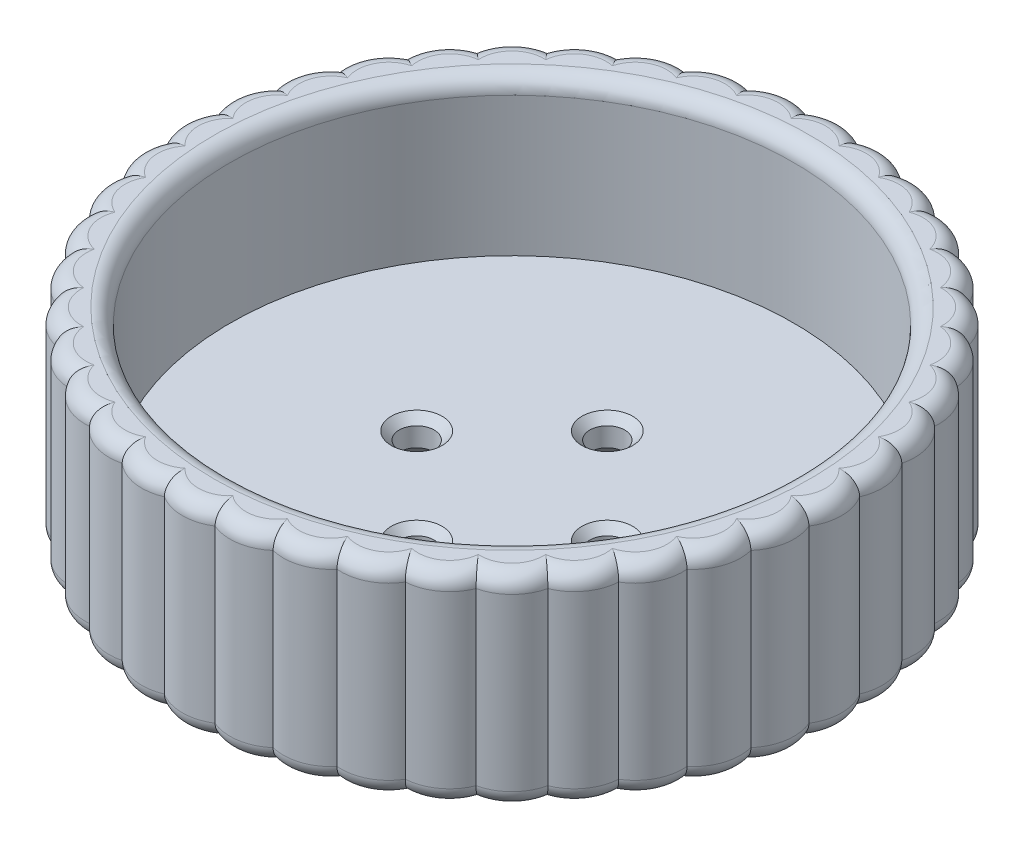
from build123d import *

# Parameters (mm, degrees)
SKETCH1_R           = 17.75
BOSS_EXTRUDE1_DEPTH = 3
SKETCH1_6_R         = 20.749999999999996
SKETCH1_6_R_2       = 17.75
BOSS_EXTRUDE2_DEPTH = 12.750000000000002
CHAMFER1_SIZE       = 1.3
FILLET3_R           = 1
CHAMFER2_SIZE       = 0.5
CUT_EXTRUDE7_DEPTH  = 12.75
FILLET7_R           = 1
FILLET8_R           = 1


with BuildPart() as part:
    # Sketch1 → Boss-Extrude1 (new body)
    # profile 1 of 2: a face of its own
    with BuildSketch(Plane(origin=(0, 0, 0), x_dir=(1, 0, 0), z_dir=(0, 1, 0))):
        with Locations(Location((0, 0, 0), (0, 0, 270))):
            Circle(SKETCH1_R)
        with BuildLine():
            ThreePointArc((-1.0953687228001776, -5.899166666666668), (-4.242640687119286, -4.242640687119284), (-5.899166666666668, -1.0953687228001758))
            ThreePointArc((-5.899166666666666, -1.0953687228001934), (-7.1, -1.917e-14), (-5.89916666666667, 1.0953687228001592))
            ThreePointArc((-5.899166666666668, 1.0953687228001765), (-4.242640687119286, 4.242640687119286), (-1.0953687228001763, 5.899166666666668))
            ThreePointArc((-1.095368722800176, 5.899166666666668), (-0.05046981731592814, 7.098841570718955), (1.1, 6.000000000000001))
            ThreePointArc((1.1, 6.000000000000001), (1.0988415707189536, 5.9495301826840725), (1.095368722800176, 5.899166666666669))
            ThreePointArc((1.0953687228001767, 5.899166666666669), (4.242640687119286, 4.2426406871192865), (5.899166666666668, 1.0953687228001765))
            ThreePointArc((5.899166666666668, 1.095368722800176), (6.741310776035711, 0.8126858761743884), (7.100000000000001, 0))
            ThreePointArc((7.100000000000001, -2.7e-16), (6.741310776035711, -0.8126858761743889), (5.899166666666668, -1.095368722800176))
            ThreePointArc((5.899166666666668, -1.0953687228001752), (4.242640687119286, -4.242640687119285), (1.0953687228001758, -5.899166666666668))
            ThreePointArc((1.095368722800176, -5.899166666666668), (1.0988415707189536, -5.9495301826840725), (1.1, -6.000000000000001))
            ThreePointArc((1.1, -6.000000000000001), (-0.05046981731592792, -7.098841570718955), (-1.095368722800176, -5.899166666666668))
        make_face(mode=Mode.SUBTRACT)
    # profile 2 of 2: a face of its own
    with BuildSketch(Plane(origin=(0, 0, 0), x_dir=(1, 0, 0), z_dir=(0, 1, 0))):
        with BuildLine():
            ThreePointArc((-4.899999999999999, -1.762e-14), (-5.187314123825611, -0.7413107760357274), (-5.899166666666666, -1.0953687228001934))
            ThreePointArc((-5.899166666666668, -1.0953687228001758), (-4.242640687119286, -4.242640687119284), (-1.0953687228001776, -5.899166666666668))
            ThreePointArc((-1.095368722800176, -5.899166666666668), (7e-17, -4.9), (1.095368722800176, -5.899166666666668))
            ThreePointArc((1.0953687228001758, -5.899166666666668), (4.242640687119286, -4.242640687119285), (5.899166666666668, -1.0953687228001752))
            ThreePointArc((5.899166666666668, -1.095368722800176), (4.9, 1.3e-16), (5.899166666666668, 1.095368722800176))
            ThreePointArc((5.899166666666668, 1.0953687228001765), (4.242640687119286, 4.2426406871192865), (1.0953687228001767, 5.899166666666669))
            ThreePointArc((1.095368722800176, 5.899166666666669), (-2e-16, 4.9), (-1.095368722800176, 5.899166666666668))
            ThreePointArc((-1.0953687228001763, 5.899166666666668), (-4.242640687119286, 4.242640687119286), (-5.899166666666668, 1.0953687228001765))
            ThreePointArc((-5.89916666666667, 1.0953687228001592), (-5.187314123825612, 0.7413107760356942), (-4.899999999999999, -1.735e-14))
        make_face()
    extrude(amount=BOSS_EXTRUDE1_DEPTH)

    # Sketch1<6> → Boss-Extrude2 (add)
    with BuildSketch(Plane(origin=(0, 0, 0), x_dir=(1, 0, 0), z_dir=(0, 1, 0))):
        with Locations(Location((0, 0, 0), (0, 0, 270))):
            Circle(SKETCH1_6_R)
        with Locations(Location((0, 0, 0), (0, 0, 270))):
            Circle(SKETCH1_6_R_2, mode=Mode.SUBTRACT)
    extrude(amount=BOSS_EXTRUDE2_DEPTH)

    # Chamfer1
    chamfer1_edges = [part.edges().sort_by_distance(p)[0] for p in [
        (-1.1000000000000003, 0, -6.000000000000003),
        (-6.10083333333333, 0, 1.0953687228001936),
        (1.095368722800179, 0, 6.100833333333297),
        (6.100833333333332, 0, -1.0953687228001763),
    ]]
    chamfer(chamfer1_edges, length=CHAMFER1_SIZE)

    # Fillet3
    fillet3_edges = [part.edges().sort_by_distance(p)[0] for p in [
        (5.43e-15, 12.750000000000002, -17.75),
    ]]
    fillet(fillet3_edges, radius=FILLET3_R)

    # Chamfer2
    chamfer2_edges = [part.edges().sort_by_distance(p)[0] for p in [
        (1.0953687228001758, 3, 6.100833333333332),
        (-6.100833333333331, 3, 1.0953687228001932),
        (-1.0999999999999992, 3, -6.000000000000004),
        (6.100833333333332, 3, -1.0953687228001758),
    ]]
    chamfer(chamfer2_edges, length=CHAMFER2_SIZE)

    # Sketch3 → Cut-Extrude7 (cut)
    with BuildSketch(Plane.XZ):
        with BuildLine():
            ThreePointArc((1.504e-14, -20.75), (-0.8309255876076782, -20.63263120566243), (-1.596834685614202, -20.289708445239214))
            ThreePointArc((-1.5968346856142022, -20.289708445239214), (-2.406959065835514, -20.508594671901903), (-3.246015061179554, -20.494533081351122))
            ThreePointArc((-3.2460150611795546, -20.49453308135112), (-1.6280261917371357, -20.68603467847373), (1.462e-14, -20.749999999999996))
        make_face()
        with BuildLine():
            ThreePointArc((1.5968346856140667, -20.2897084452393), (0.830925587607616, -20.63263120566245), (1.504e-14, -20.75))
            ThreePointArc((1.462e-14, -20.749999999999996), (1.628026245773744, -20.686034674220956), (3.2460151682522507, -20.49453306439247))
            ThreePointArc((3.2460151682522507, -20.49453306439247), (2.4069591196258613, -20.508594678582632), (1.5968346856140667, -20.2897084452393))
        make_face()
        with BuildLine():
            ThreePointArc((-6.412102755472179, -19.73442267342184), (-4.843991318958151, -20.176675843702746), (-3.2460150611795546, -20.49453308135112))
            ThreePointArc((-3.246015061179554, -20.494533081351122), (-4.048350099278278, -20.24862389681667), (-4.7511846872923105, -19.79010848563573))
            ThreePointArc((-4.7511846872923105, -19.79010848563573), (-5.58557655077396, -19.879568481939167), (-6.412102755472179, -19.73442267342184))
        make_face()
        with BuildLine():
            ThreePointArc((4.751184687291881, -19.790108485635756), (4.048350148371343, -20.24862387384081), (3.2460151682522507, -20.49453306439247))
            ThreePointArc((3.2460151682522507, -20.49453306439247), (4.84399143676177, -20.1766758154206), (6.412102882813598, -19.7344226320461))
            ThreePointArc((6.412102882813598, -19.7344226320461), (5.5855766176835, -19.879568479695937), (4.751184687291881, -19.790108485635756))
        make_face()
        with BuildLine():
            ThreePointArc((-9.420303037690964, -18.48838529125976), (-7.94068136807432, -19.170500238927445), (-6.412102755472179, -19.73442267342184))
            ThreePointArc((-6.412102755472179, -19.73442267342184), (-7.166090929078669, -19.36602819283148), (-7.788544753691339, -18.803210375511387))
            ThreePointArc((-7.788544753691339, -18.803210375511387), (-8.62665852494776, -18.76104132031222), (-9.420303037690964, -18.48838529125976))
        make_face()
        with BuildLine():
            ThreePointArc((7.78854475369123, -18.803210375511515), (7.166090984528289, -19.366028155317807), (6.412102882813598, -19.7344226320461))
            ThreePointArc((6.412102882813598, -19.7344226320461), (7.94068142992548, -19.170500213307854), (9.42030303769071, -18.48838529125989))
            ThreePointArc((9.42030303769071, -18.48838529125989), (8.626658524947578, -18.761041320312327), (7.78854475369123, -18.803210375511515))
        make_face()
        with BuildLine():
            ThreePointArc((-12.196544154008901, -16.787102510538), (-10.841845387309332, -17.692283306506233), (-9.420303037690964, -18.48838529125976))
            ThreePointArc((-9.420303037690964, -18.48838529125976), (-10.10737874057215, -18.0065766282252), (-10.634124999556406, -17.353314821664526))
            ThreePointArc((-10.634124999556406, -17.353314821664526), (-11.455323515405839, -17.18055505462606), (-12.196544154008901, -16.787102510538))
        make_face()
        with BuildLine():
            ThreePointArc((10.634124999556162, -17.35331482166467), (10.1073787405719, -18.00657662822534), (9.42030303769071, -18.48838529125989))
            ThreePointArc((9.42030303769071, -18.48838529125989), (10.841845351928214, -17.692283328187813), (12.196544086867277, -16.787102559319244))
            ThreePointArc((12.196544086867277, -16.787102559319244), (11.45532347639271, -17.180555068764267), (10.634124999556162, -17.35331482166467))
        make_face()
        with BuildLine():
            ThreePointArc((-14.672465709620866, -14.67246570962085), (-13.476047082245849, -15.778423718391295), (-12.196544154008901, -16.787102510538))
            ThreePointArc((-12.196544154008901, -16.787102510538), (-12.799789324280527, -16.203743395537334), (-13.217857795294947, -15.47612306455828))
            ThreePointArc((-13.217857795294945, -15.47612306455828), (-14.00192032158628, -15.177026556903868), (-14.672465709620873, -14.672465709620854))
        make_face()
        with BuildLine():
            ThreePointArc((13.217857795294794, -15.476123064558447), (12.799789298778594, -16.203743428272062), (12.196544086867277, -16.787102559319244))
            ThreePointArc((12.196544086867277, -16.787102559319244), (13.47604705069206, -15.778423745340778), (14.672465709620633, -14.672465709621083))
            ThreePointArc((14.672465709620635, -14.672465709621083), (14.001920321586077, -15.177026556904053), (13.217857795294794, -15.476123064558447))
        make_face()
        with BuildLine():
            ThreePointArc((-16.787102784592182, -12.196543776805672), (-15.778423869793505, -13.476046904976638), (-14.672465709620866, -14.67246570962085))
            ThreePointArc((-14.672465709620873, -14.672465709620854), (-15.177026556903906, -14.00192032158625), (-15.476123064558326, -13.217857795294895))
            ThreePointArc((-15.476123064558326, -13.217857795294895), (-16.20374357944151, -12.799789181010635), (-16.787102784592182, -12.196543776805672))
        make_face()
        with BuildLine():
            ThreePointArc((15.476123064558138, -13.217857795295108), (15.177026556903698, -14.001920321586475), (14.672465709620635, -14.672465709621083))
            ThreePointArc((14.672465709620633, -14.672465709621083), (15.778423788945274, -13.476046999637756), (16.787102638248435, -12.196543978230569))
            ThreePointArc((16.787102638248435, -12.196543978230569), (16.203743481237414, -12.799789257516254), (15.476123064558138, -13.21785779529511))
        make_face()
        with BuildLine():
            ThreePointArc((-18.4883852912597, -9.420303037691081), (-17.692283428313374, -10.84184518853815), (-16.787102784592182, -12.196543776805672))
            ThreePointArc((-16.787102784592182, -12.196543776805672), (-17.180555134054305, -11.455323296229743), (-17.353314821664558, -10.634124999556347))
            ThreePointArc((-17.353314821664558, -10.634124999556347), (-18.006576628225165, -10.107378740572162), (-18.4883852912597, -9.420303037691081))
        make_face()
        with BuildLine():
            ThreePointArc((17.353314821664426, -10.63412499955657), (17.180555091639874, -11.45532341326891), (16.787102638248435, -12.196543978230569))
            ThreePointArc((16.787102638248435, -12.196543978230569), (17.692283420533393, -10.841845201233923), (18.48838539077212, -9.420302842386963))
            ThreePointArc((18.488385390772116, -9.420302842386963), (18.006576703081926, -10.10737866052191), (17.353314821664426, -10.63412499955657))
        make_face()
        with BuildLine():
            ThreePointArc((-19.7344227403654, -6.4121025494410855), (-19.17050028037852, -7.9406812680025745), (-18.4883852912597, -9.420303037691081))
            ThreePointArc((-18.4883852912597, -9.420303037691081), (-18.761041320312234, -8.626658524947793), (-18.80321037551142, -7.788544753691268))
            ThreePointArc((-18.80321037551142, -7.788544753691269), (-19.3660282535265, -7.166090839364205), (-19.7344227403654, -6.4121025494410855))
        make_face()
        with BuildLine():
            ThreePointArc((18.803210375511274, -7.788544753691565), (18.76104134107452, -8.626658417335067), (18.488385390772116, -9.420302842386963))
            ThreePointArc((18.48838539077212, -9.420302842386963), (19.170500271082194, -7.940681290445895), (19.734422657616854, -6.412102804114917))
            ThreePointArc((19.734422657616854, -6.412102804114917), (19.366028178501715, -7.166090950259853), (18.803210375511274, -7.788544753691565))
        make_face()
        with BuildLine():
            ThreePointArc((-20.49453302647154, -3.2460154076755545), (-20.176675828040754, -4.843991384195048), (-19.7344227403654, -6.4121025494410855))
            ThreePointArc((-19.7344227403654, -6.4121025494410855), (-19.879568485568697, -5.585576442517798), (-19.79010848563574, -4.751184687292243))
            ThreePointArc((-19.79010848563574, -4.751184687292243), (-20.248623822465003, -4.048350258148131), (-20.49453302647154, -3.246015407675554))
        make_face()
        with BuildLine():
            ThreePointArc((19.790108485635674, -4.751184687292528), (19.879568481082202, -5.585576576332704), (19.734422657616854, -6.412102804114917))
            ThreePointArc((19.734422657616854, -6.412102804114917), (20.17667580645126, -4.843991474121749), (20.49453303942681, -3.2460153258792235))
            ThreePointArc((20.49453303942681, -3.2460153258792226), (20.248623840016997, -4.048350220644322), (19.790108485635674, -4.751184687292527))
        make_face()
        with BuildLine():
            ThreePointArc((-20.749999999999996, 2.54e-15), (-20.68603466471141, -1.6280263666039725), (-20.49453302647154, -3.2460154076755545))
            ThreePointArc((-20.49453302647154, -3.246015407675554), (-20.508594693521054, -2.406959239905647), (-20.28970844523922, -1.5968346856141253))
            ThreePointArc((-20.28970844523922, -1.5968346856141253), (-20.632631205662424, -0.830925587607626), (-20.749999999999996, 3.936e-14))
        make_face()
        with BuildLine():
            ThreePointArc((20.28970844523918, -1.5968346856144433), (20.508594688417425, -2.406959198813552), (20.49453303942681, -3.2460153258792226))
            ThreePointArc((20.49453303942681, -3.2460153258792235), (20.686034667960243, -1.6280263253236613), (20.749999999999996, -5.08e-15))
            ThreePointArc((20.75, 3.9e-16), (20.632631205662445, -0.8309255876078128), (20.28970844523918, -1.5968346856144433))
        make_face()
        with BuildLine():
            ThreePointArc((-20.49453304743366, 3.2460152753259623), (-20.686034669968144, 1.6280262998108346), (-20.749999999999996, 2.54e-15))
            ThreePointArc((-20.749999999999996, 3.936e-14), (-20.632631205662427, 0.8309255876077399), (-20.289708445239206, 1.59683468561427))
            ThreePointArc((-20.289708445239206, 1.59683468561427), (-20.508594685263255, 2.4069591734168827), (-20.49453304743366, 3.246015275325963))
        make_face()
        with BuildLine():
            ThreePointArc((20.289708445239235, 1.5968346856139866), (20.632631205662406, 0.8309255876075723), (20.75, 3.9e-16))
            ThreePointArc((20.749999999999996, 0), (20.686034665715365, 1.6280263538475206), (20.49453303047498, 3.246015382398844))
            ThreePointArc((20.49453303047498, 3.246015382398844), (20.508594691943976, 2.406959227207245), (20.289708445239235, 1.5968346856139861))
        make_face()
        with BuildLine():
            ThreePointArc((-19.734422647849073, 6.412102834177055), (-20.176675808736015, 4.843991464605062), (-20.49453304743366, 3.2460152753259623))
            ThreePointArc((-20.49453304743366, 3.246015275325963), (-20.248623850864792, 4.048350197465354), (-19.790108485635713, 4.751184687292378))
            ThreePointArc((-19.790108485635713, 4.751184687292378), (-19.879568480552656, 5.585576592128359), (-19.734422647849073, 6.412102834177055))
        make_face()
        with BuildLine():
            ThreePointArc((19.790108485635777, 4.751184687292101), (20.24862382788892, 4.048350246558575), (20.49453303047498, 3.246015382398844))
            ThreePointArc((20.49453303047498, 3.246015382398844), (20.17667579011303, 4.843991542175382), (19.7344226320455, 6.4121028828154465))
            ThreePointArc((19.7344226320455, 6.412102882815446), (19.879568479695898, 5.585576617684582), (19.790108485635777, 4.751184687292102))
        make_face()
        with BuildLine():
            ThreePointArc((-18.488385414264116, 9.420302796281327), (-19.17050027493511, 7.940681281144122), (-19.734422647849073, 6.412102834177055))
            ThreePointArc((-19.734422647849073, 6.412102834177055), (-19.366028169645684, 7.166090963350056), (-18.80321037551136, 7.788544753691413))
            ThreePointArc((-18.80321037551136, 7.788544753691412), (-18.761041345975986, 8.626658391930725), (-18.488385414264116, 9.420302796281327))
        make_face()
        with BuildLine():
            ThreePointArc((18.803210375511476, 7.788544753691147), (19.36602815531725, 7.1660909845290615), (19.7344226320455, 6.412102882815446))
            ThreePointArc((19.7344226320455, 6.4121028828154465), (19.17050022932755, 7.940681391250512), (18.488385329270205, 9.420302963091268))
            ThreePointArc((18.488385329270205, 9.420302963091268), (18.761041328242843, 8.62665848384313), (18.803210375511476, 7.788544753691148))
        make_face()
        with BuildLine():
            ThreePointArc((-16.787102510538258, 12.196544154008542), (-17.69228337728933, 10.841845271801828), (-18.488385414264116, 9.420302796281327))
            ThreePointArc((-18.488385414264116, 9.420302796281327), (-18.006576720753458, 10.107378641624276), (-17.35331482166448, 10.634124999556471))
            ThreePointArc((-17.353314821664483, 10.634124999556471), (-17.1805550546261, 11.45532351540566), (-16.787102510538258, 12.196544154008542))
        make_face()
        with BuildLine():
            ThreePointArc((17.35331482166463, 10.63412499955622), (18.006576656818044, 10.107378709995448), (18.488385329270205, 9.420302963091268))
            ThreePointArc((18.488385329270205, 9.420302963091268), (17.692283350060944, 10.841845316234512), (16.787102559319383, 12.196544086867087))
            ThreePointArc((16.787102559319383, 12.196544086867084), (17.180555068764285, 11.455323476392625), (17.35331482166463, 10.63412499955622))
        make_face()
        with BuildLine():
            ThreePointArc((-14.672465709620793, 14.672465709620925), (-15.778423718391418, 13.476047082245705), (-16.787102510538258, 12.196544154008542))
            ThreePointArc((-16.787102510538258, 12.196544154008542), (-16.20374339553749, 12.799789324280423), (-15.476123064558234, 13.217857795294998))
            ThreePointArc((-15.476123064558234, 13.217857795294998), (-15.177026556903817, 14.001920321586336), (-14.672465709620797, 14.672465709620926))
        make_face()
        with BuildLine():
            ThreePointArc((15.476123064558418, 13.217857795294776), (16.203743428272144, 12.79978929877852), (16.787102559319383, 12.196544086867084))
            ThreePointArc((16.787102559319383, 12.196544086867087), (15.778423758762058, 13.476047034977759), (14.672465738846594, 14.672465680395122))
            ThreePointArc((14.672465738846594, 14.672465680395124), (15.177026566897732, 14.001920303497636), (15.476123064558418, 13.217857795294778))
        make_face()
        with BuildLine():
            ThreePointArc((-12.196543828097262, 16.787102747326664), (-13.476046929081438, 15.778423849206062), (-14.672465709620793, 14.672465709620925))
            ThreePointArc((-14.672465709620797, 14.672465709620926), (-14.001920321586187, 15.177026556903957), (-13.217857795294831, 15.476123064558374))
            ThreePointArc((-13.217857795294831, 15.476123064558374), (-12.799789200492238, 16.203743554434485), (-12.196543828097262, 16.787102747326664))
        make_face()
        with BuildLine():
            ThreePointArc((13.217857795295059, 15.476123064558186), (14.00192033967489, 15.177026546910039), (14.672465738846594, 14.672465680395124))
            ThreePointArc((14.672465738846594, 14.672465680395122), (13.476047054354181, 15.77842374221303), (12.196544061221651, 16.78710257795188))
            ThreePointArc((12.196544061221651, 16.78710257795188), (12.799789289038014, 16.203743440775412), (13.217857795295057, 15.476123064558186))
        make_face()
        with BuildLine():
            ThreePointArc((-9.42030303769077, 18.48838529125986), (-10.841845215566646, 17.69228341175029), (-12.196543828097262, 16.787102747326664))
            ThreePointArc((-12.196543828097262, 16.787102747326664), (-11.455323326032987, 17.18055512325379), (-10.634124999556295, 17.353314821664593))
            ThreePointArc((-10.634124999556295, 17.353314821664593), (-10.107378740572003, 18.006576628225293), (-9.42030303769077, 18.48838529125986))
        make_face()
        with BuildLine():
            ThreePointArc((10.634124999556542, 17.35331482166443), (11.45532346149134, 17.18055507416433), (12.196544061221651, 16.78710257795188))
            ThreePointArc((12.196544061221651, 16.78710257795188), (10.841845338414267, 17.692283336469174), (9.420303037691289, 18.488385291259593))
            ThreePointArc((9.420303037691289, 18.488385291259593), (10.107378740572367, 18.006576628225048), (10.634124999556542, 17.35331482166443))
        make_face()
        with BuildLine():
            ThreePointArc((-6.412102534457471, 19.734422745233868), (-7.940681260724685, 19.17050028339312), (-9.42030303769077, 18.48838529125986))
            ThreePointArc((-9.42030303769077, 18.48838529125986), (-8.626658524947583, 18.761041320312295), (-7.788544753691184, 18.803210375511448))
            ThreePointArc((-7.788544753691184, 18.803210375511448), (-7.166090832839673, 19.36602825794055), (-6.41210253445747, 19.734422745233864))
        make_face()
        with BuildLine():
            ThreePointArc((7.7885447536914665, 18.80321037551134), (8.626658524947999, 18.761041320312142), (9.420303037691289, 18.488385291259593))
            ThreePointArc((9.420303037691289, 18.488385291259593), (7.940681429926838, 19.170500213307292), (6.412102882815772, 19.734422632045394))
            ThreePointArc((6.412102882815772, 19.734422632045394), (7.166090984529387, 19.366028155317128), (7.7885447536914665, 18.80321037551134))
        make_face()
        with BuildLine():
            ThreePointArc((-3.246015061179349, 20.49453308135115), (-4.843991205974209, 20.17667587082779), (-6.412102534457471, 19.734422745233868))
            ThreePointArc((-6.41210253445747, 19.734422745233864), (-5.585576434644835, 19.879568485832667), (-4.751184687292174, 19.790108485635756))
            ThreePointArc((-4.751184687292174, 19.790108485635756), (-4.04835009927811, 20.248623896816706), (-3.246015061179349, 20.49453308135115))
        make_face()
        with BuildLine():
            ThreePointArc((4.751184687292442, 19.790108485635688), (5.585576617684916, 19.8795684796958), (6.412102882815772, 19.734422632045394))
            ThreePointArc((6.412102882815772, 19.734422632045394), (4.843991451769691, 20.176675811817518), (3.2460151987386774, 20.494533059563892))
            ThreePointArc((3.2460151987386765, 20.49453305956389), (4.048350162349793, 20.248623867299006), (4.751184687292442, 19.790108485635688))
        make_face()
        with BuildLine():
            ThreePointArc((1.3949e-13, 20.749999999999996), (-1.6280261917369607, 20.686034678473742), (-3.246015061179349, 20.49453308135115))
            ThreePointArc((-3.246015061179349, 20.49453308135115), (-2.406959065835343, 20.508594671901914), (-1.5968346856140665, 20.289708445239224))
            ThreePointArc((-1.5968346856140672, 20.289708445239224), (-0.8309255876075474, 20.632631205662435), (1.3922e-13, 20.75))
        make_face()
        with BuildLine():
            ThreePointArc((1.596834685614355, 20.289708445239196), (2.406959134941555, 20.50859468048468), (3.2460151987386765, 20.49453305956389))
            ThreePointArc((3.2460151987386774, 20.494533059563892), (1.6280262611594456, 20.686034673010074), (1.3949e-13, 20.749999999999996))
            ThreePointArc((1.3922e-13, 20.75), (0.8309255876078331, 20.63263120566242), (1.5968346856143552, 20.289708445239196))
        make_face()
    extrude(amount=-CUT_EXTRUDE7_DEPTH, mode=Mode.SUBTRACT)

    # Fillet7
    fillet7_edges = [part.edges().sort_by_distance(p)[0] for p in [
        (9.420302869595755, 12.75, 18.488385376908553),
        (6.412102633280311, 12.75, 19.734422713124392),
        (18.48838537690872, 12.75, 9.420302869595425),
        (16.78710263328027, 12.75, 12.196543985068658),
        (9.420302869595425, 12.75, -18.48838537690872),
        (12.196543985068626, 12.75, -16.7871026332803),
        (3.246015149584525, 12.75, -20.49453306734915),
        (6.412102633279883, 12.75, -19.73442271312453),
        (-3.246015149584796, 12.75, -20.49453306734911),
        (-7.835e-14, 12.75, -20.75),
        (-9.420302869595616, 12.75, -18.488385376908624),
        (-6.412102633280177, 12.75, -19.73442271312443),
        (-14.672465709620889, 12.75, -14.672465709620838),
        (-12.196543985068839, 12.75, -16.787102633280146),
        (-18.488385376908656, 12.75, -9.420302869595549),
        (-16.78710263328019, 12.75, -12.196543985068786),
        (-20.494533067349124, 12.75, -3.2460151495847223),
        (-19.734422713124452, 12.75, -6.412102633280103),
        (-20.494533067349096, 12.75, 3.2460151495848675),
        (-20.749999999999996, 12.75, 7.375e-14),
        (-18.488385376908585, 12.75, 9.420302869595684),
        (-19.73442271312441, 12.75, 6.412102633280249),
        (-14.672465709620784, 12.75, 14.67246570962094),
        (-16.7871026332801, 12.75, 12.196543985068901),
        (-9.42030286959548, 12.75, 18.488385376908695),
        (-12.196543985068725, 12.75, 16.787102633280227),
        (-3.2460151495846583, 12.75, 20.494533067349124),
        (-6.412102633280025, 12.75, 19.734422713124474),
        (3.2460151495849416, 12.75, 20.494533067349078),
        (1.4647e-13, 12.75, 20.75),
        (14.672465709620703, 12.75, -14.672465709621015),
        (16.787102633280018, 12.75, -12.196543985069008),
        (18.488385376908514, 12.75, -9.420302869595812),
        (19.734422713124356, 12.75, -6.412102633280408),
        (20.49453306734907, 12.75, -3.2460151495850287),
        (20.75, 12.75, -2.3789e-13),
        (20.494533067349145, 12.75, 3.246015149584581),
        (19.734422713124502, 12.75, 6.41210263327997),
        (14.67246570962099, 12.75, 14.672465709620727),
        (12.196543985068965, 12.75, 16.787102633280046),
    ]]
    fillet(fillet7_edges, radius=FILLET7_R)

    # Fillet8
    fillet8_edges = [part.edges().sort_by_distance(p)[0] for p in [
        (6.412102633280307, 0, 19.734422713124392),
        (9.420302869595755, 0, 18.488385376908553),
        (16.78710263328027, 0, 12.19654398506866),
        (18.48838537690872, 0, 9.420302869595421),
        (12.196543985068626, 0, -16.7871026332803),
        (9.420302869595426, 0, -18.48838537690872),
        (6.4121026332798845, 0, -19.73442271312453),
        (3.246015149584526, 0, -20.49453306734915),
        (-8.052e-14, 0, -20.75),
        (-3.246015149584796, 0, -20.49453306734911),
        (-6.412102633280176, 0, -19.73442271312443),
        (-9.420302869595613, 0, -18.488385376908624),
        (-12.19654398506884, 0, -16.787102633280146),
        (-14.672465709620887, 0, -14.67246570962084),
        (-16.78710263328019, 0, -12.196543985068786),
        (-18.488385376908656, 0, -9.420302869595549),
        (-19.734422713124452, 0, -6.412102633280105),
        (-20.494533067349124, 0, -3.2460151495847245),
        (-20.749999999999996, 0, 7.594e-14),
        (-20.494533067349096, 0, 3.2460151495848644),
        (-19.73442271312441, 0, 6.4121026332802495),
        (-18.488385376908585, 0, 9.420302869595684),
        (-16.787102633280103, 0, 12.1965439850689),
        (-14.672465709620782, 0, 14.67246570962094),
        (-12.196543985068725, 0, 16.787102633280227),
        (-9.420302869595478, 0, 18.488385376908695),
        (-6.412102633280027, 0, 19.73442271312447),
        (-3.2460151495846574, 0, 20.494533067349128),
        (1.4802e-13, 0, 20.75),
        (3.24601514958494, 0, 20.494533067349078),
        (16.78710263328002, 0, -12.196543985069006),
        (14.672465709620703, 0, -14.672465709621015),
        (19.734422713124356, 0, -6.4121026332804085),
        (18.488385376908518, 0, -9.42030286959581),
        (20.75, 0, -2.3684e-13),
        (20.494533067349074, 0, -3.2460151495850273),
        (19.734422713124502, 0, 6.412102633279971),
        (20.494533067349145, 0, 3.2460151495845797),
        (12.196543985068967, 0, 16.787102633280046),
        (14.672465709620992, 0, 14.672465709620727),
    ]]
    fillet(fillet8_edges, radius=FILLET8_R)


solid = part.part
